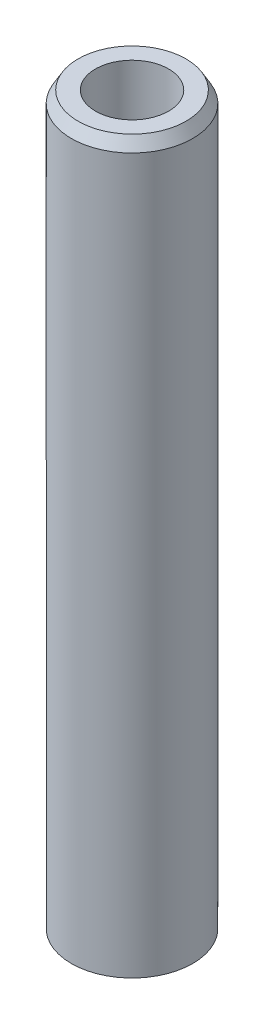
from build123d import *
from OCP.BRepFilletAPI import BRepFilletAPI_MakeChamfer

# Parameters (mm, degrees)
SKETCH1_R           = 10
BOSS_EXTRUDE1_DEPTH = 120.70317479
SKETCH2_R           = 6.025904957
CUT_EXTRUDE1_DEPTH  = 122.528829519
CHAMFER1_SIZE       = 1.914923412
CHAMFER1_SIZE2      = 1.105581548


with BuildPart() as part:
    # Sketch1 → Boss-Extrude1 (new body)
    with BuildSketch(Plane(origin=(0, 0, 0), x_dir=(1, 0, 0), z_dir=(0, 1, 0))):
        Circle(SKETCH1_R)
    extrude(amount=BOSS_EXTRUDE1_DEPTH)

    # Sketch2 → Cut-Extrude1 (cut, through all)
    with BuildSketch(Plane(origin=(0, 0, 0), x_dir=(1, 0, 0), z_dir=(0, 1, 0))):
        Circle(SKETCH2_R)
    extrude(amount=CUT_EXTRUDE1_DEPTH, mode=Mode.SUBTRACT)

    # Chamfer1: one chamfer whose edges measure the first distance from different faces: ONE call of the kernel's chamfer builder (chamfer() names one face for all edges)
    chamfer1_edges_1 = [part.edges().sort_by_distance(p)[0] for p in [
        (-10, 120.70317479, 0),
    ]]
    chamfer1_side_1 = [part.faces().sort_by_distance(p)[0] for p in [
        (-10, 60.351587395, 0),
    ]]
    chamfer1_edges_2 = [part.edges().sort_by_distance(p)[0] for p in [
        (-10, 0, 0),
    ]]
    chamfer1_side_2 = [part.faces().sort_by_distance(p)[0] for p in [
        (-9.717157288, 0, 0),
    ]]
    chamfer1 = BRepFilletAPI_MakeChamfer(part.part.solid().wrapped)
    for e in chamfer1_edges_1:
        chamfer1.Add(CHAMFER1_SIZE, CHAMFER1_SIZE2, e.wrapped, chamfer1_side_1[0].wrapped)  # the first distance lies on this face
    for e in chamfer1_edges_2:
        chamfer1.Add(CHAMFER1_SIZE, CHAMFER1_SIZE2, e.wrapped, chamfer1_side_2[0].wrapped)  # the first distance lies on this face
    add(Compound.cast(chamfer1.Shape()), mode=Mode.REPLACE)


solid = part.part
